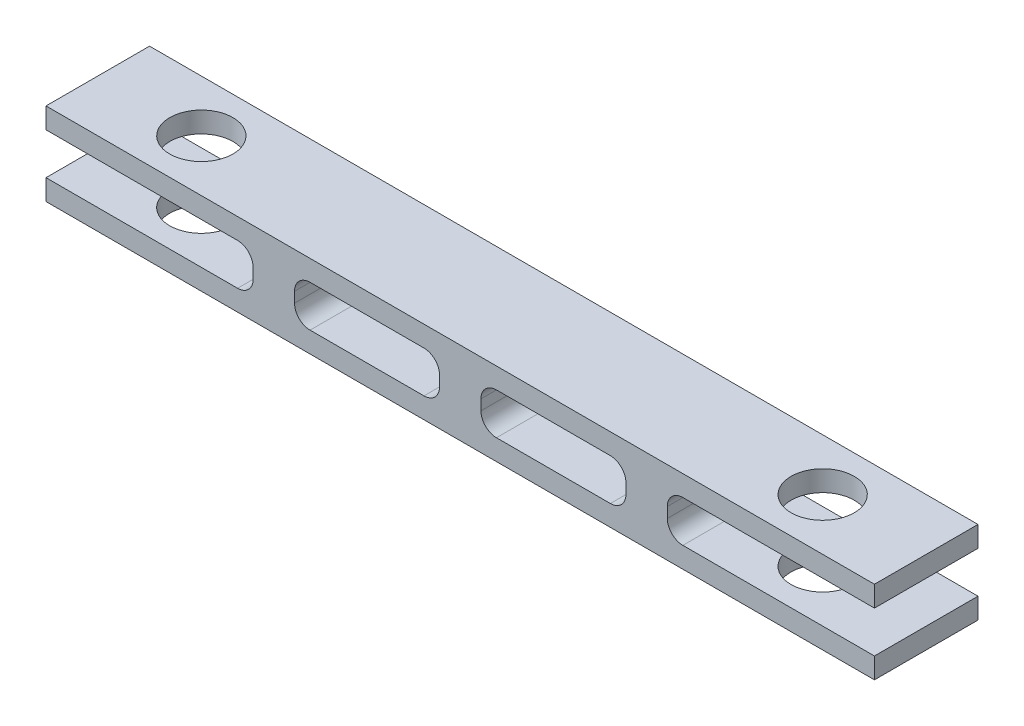
from build123d import *

# Parameters (mm, degrees)
SKETCH1_W           = 40
SKETCH1_H           = 5
BOSS_EXTRUDE1_DEPTH = 4
SKETCH2_R           = 1.525
CUT_EXTRUDE1_DEPTH  = 41.509258201
SKETCH3_W           = 10
SKETCH3_H           = 2
SKETCH3_W_2         = 7
CUT_EXTRUDE2_DEPTH  = 41.509258201
FILLET1_R           = 0.75


with BuildPart() as part:
    # Sketch1 → Boss-Extrude1 (new body)
    with BuildSketch(Plane(origin=(0, 0, 0), x_dir=(1, 0, 0), z_dir=(0, 1, 0))):
        with Locations((20, 2.5)):
            Rectangle(SKETCH1_W, SKETCH1_H)
    extrude(amount=BOSS_EXTRUDE1_DEPTH)

    # Sketch2 → Cut-Extrude1 (cut, through all)
    with BuildSketch(Plane(origin=(0, 4, 0), x_dir=(1, 0, 0), z_dir=(0, 1, 0))):
        with Locations((5, 2.5)):
            Circle(SKETCH2_R)
        with Locations((35, 2.5)):
            Circle(SKETCH2_R)
    extrude(amount=-CUT_EXTRUDE1_DEPTH, mode=Mode.SUBTRACT)

    # Sketch3 → Cut-Extrude2 (cut, through all)
    with BuildSketch(Plane(origin=(0, 0, -5), x_dir=(-1, 0, 0), z_dir=(0, 0, -1))):
        with Locations((-35, 2)):
            Rectangle(SKETCH3_W, SKETCH3_H)
        with Locations((-24.5, 2)):
            Rectangle(SKETCH3_W_2, SKETCH3_H)
        with Locations((-15.5, 2)):
            Rectangle(SKETCH3_W_2, SKETCH3_H)
        with Locations((-5, 2)):
            Rectangle(SKETCH3_W, SKETCH3_H)
    extrude(amount=-CUT_EXTRUDE2_DEPTH, mode=Mode.SUBTRACT)

    # Fillet1
    fillet1_edges = [part.edges().sort_by_distance(p)[0] for p in [
        (12, 1, -2.5),
        (21, 1, -2.5),
        (30, 1, -2.5),
        (30, 3, -2.5),
        (10, 1, -2.5),
        (19, 1, -2.5),
        (28, 1, -2.5),
        (12, 3, -2.5),
        (21, 3, -2.5),
        (10, 3, -2.5),
        (19, 3, -2.5),
        (28, 3, -2.5),
    ]]
    fillet(fillet1_edges, radius=FILLET1_R)


solid = part.part
